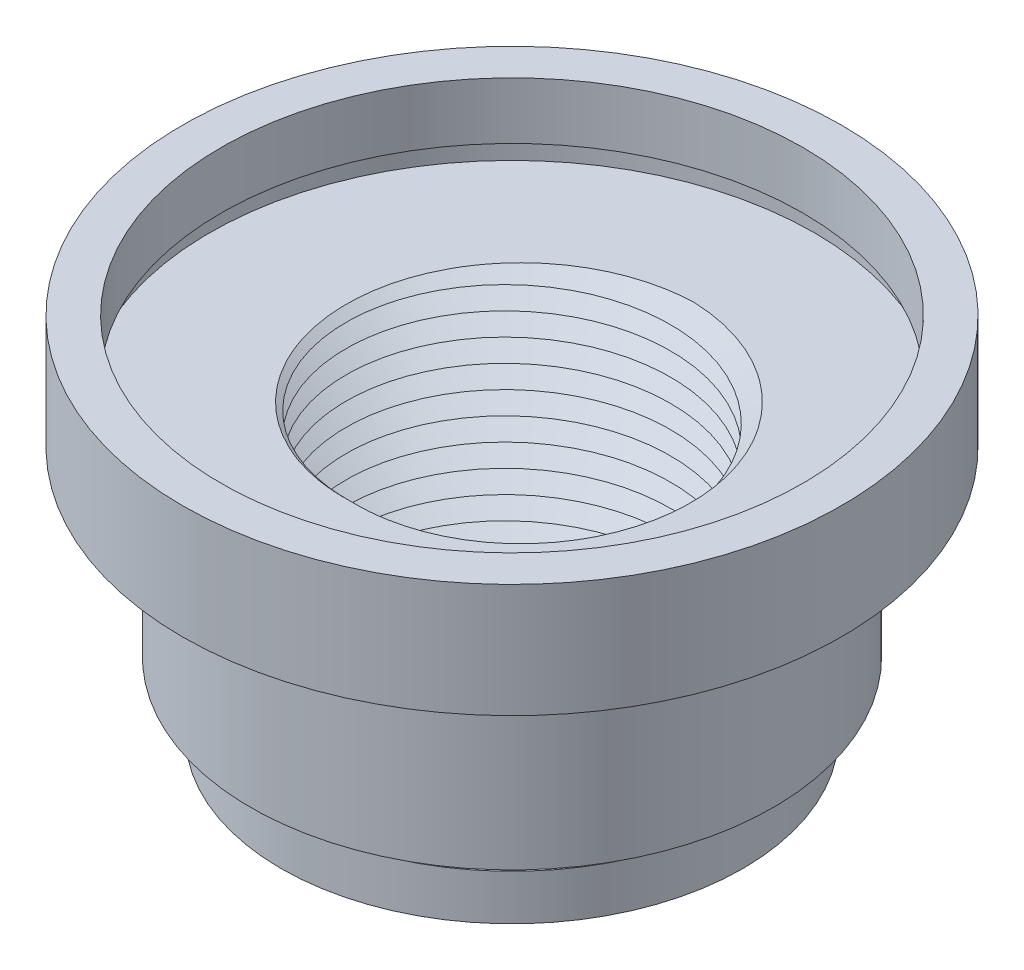
from build123d import *

# Parameters (mm, degrees)
SCHNITT_AUSTRAGUNG1_PITCH = 1


with BuildPart() as part:
    # Skizze1 → Rotation1 (revolve)
    with BuildSketch(Plane.XY, mode=Mode.PRIVATE) as rotation1_sk:
        Polygon((-10.16, 0), (-7, 0), (-7, 12.5), (-13.3, 12.5), (-13.3, 13.5), (-12.8, 13.5), (-12.8, 16), (-14.5, 16), (-14.5, 11), (-11.5, 11), (-11.5, 3), (-9.66, 3), (-9.66, 2), (-10.16, 2), align=None)
    revolve(rotation1_sk.sketch.rotate(Axis((0, -44.362033606, 0), (0, 1, 0)), 270), axis=Axis((0, -44.362033606, 0), (0, 1, 0)))

    # Schnitt-Austragung1: arcs per turn and ends read off the stored shape
    # Schnitt-Austragung1: the profile of Skizze7 profile screwed along a right-hand helix through 15 turns, 6 arcs to a turn; built about Z, then put on its axis
    schnitt_austragung1_z = Axis((0, 0, 0), (0, 0, 1))
    schnitt_austragung1_corners = [(6.9997, 0, -0.422476526), (8, 0, -1), (6.9997, 0, -1.577523474)]
    with BuildLine(mode=Mode.PRIVATE) as schnitt_austragung1_profile:
        Line(schnitt_austragung1_corners[0], schnitt_austragung1_corners[1])
        Line(schnitt_austragung1_corners[1], schnitt_austragung1_corners[2])
        Line(schnitt_austragung1_corners[2], schnitt_austragung1_corners[0])
    schnitt_austragung1_cap = Face(schnitt_austragung1_profile.wire())
    schnitt_austragung1_turn_angles = [0, 30, 60, 90, 120, 150, 180, 210, 240, 270, 300, 330, 360]
    schnitt_austragung1_turn_weights = [1, 0.8660254037844387, 1, 0.8660254037844387, 1, 0.8660254037844387, 1, 0.8660254037844387, 1, 0.8660254037844387, 1, 0.8660254037844387, 1]
    schnitt_austragung1_turn_rails = [Edge.make_bspline([Vector(p[0], p[1], 0).rotate(schnitt_austragung1_z, schnitt_austragung1_turn_angles[k]) / schnitt_austragung1_turn_weights[k] + Vector(0, 0, p[2] + SCHNITT_AUSTRAGUNG1_PITCH * schnitt_austragung1_turn_angles[k] / 360) for k in range(13)], [0, 0, 0, 1, 1, 2, 2, 3, 3, 4, 4, 5, 5, 6, 6, 6], 2, schnitt_austragung1_turn_weights) for p in schnitt_austragung1_corners]
    schnitt_austragung1_turn_sides = [Face.make_surface_from_curves(schnitt_austragung1_turn_rails[p[0]], schnitt_austragung1_turn_rails[p[1]]) for p in [(0, 1), (1, 2), (2, 0)]]
    schnitt_austragung1_turn = Solid(Shell([*schnitt_austragung1_turn_sides, schnitt_austragung1_cap, schnitt_austragung1_cap.rotate(schnitt_austragung1_z, 360).moved(Location((0, 0, SCHNITT_AUSTRAGUNG1_PITCH * 360 / 360)))]))
    schnitt_austragung1_each = [*[schnitt_austragung1_turn.moved(Location((0, 0, SCHNITT_AUSTRAGUNG1_PITCH * i))) for i in range(15)]]
    add(Plane(origin=(0, 0, 0), x_dir=(0, 0, 1), z_dir=(0, 1, 0)) * Compound([schnitt_austragung1_each[i] for i in range(0, 15, 2)]), mode=Mode.SUBTRACT)
    add(Plane(origin=(0, 0, 0), x_dir=(0, 0, 1), z_dir=(0, 1, 0)) * Compound([schnitt_austragung1_each[i] for i in range(1, 15, 2)]), mode=Mode.SUBTRACT)


solid = part.part
